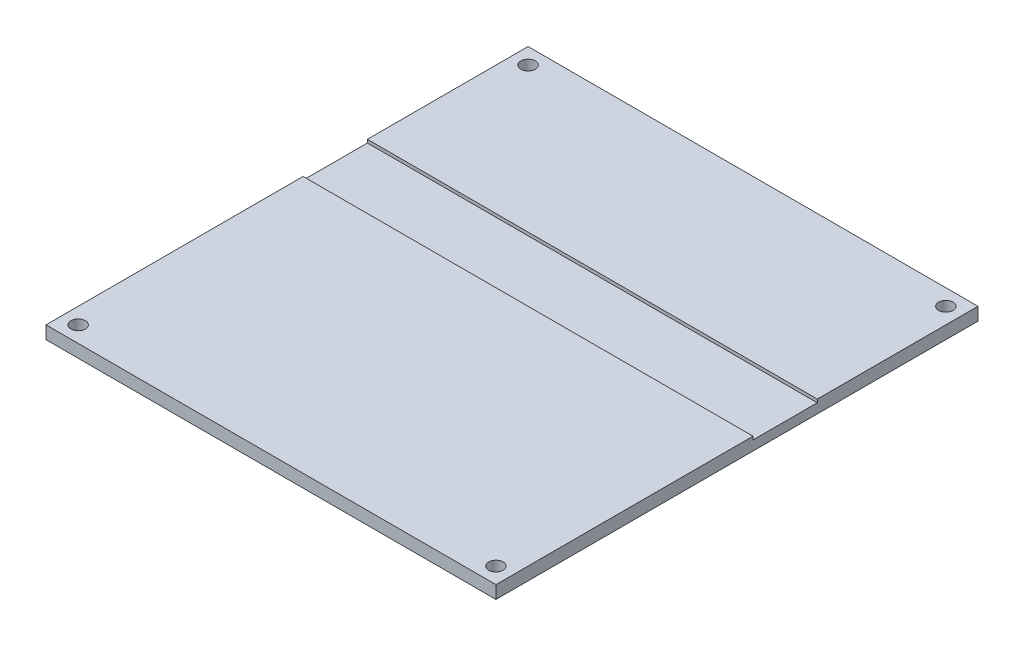
from build123d import *

# Parameters (mm, degrees)
SKETCH1_W                = 140
SKETCH1_H                = 150
BODY_DEPTH               = 4
MOUNTING_HOLES_OUTLINE_R = 2.25
MOUNTING_HOLES_DEPTH     = 4
SKETCH5_W                = 140
SKETCH5_H                = 20
CABLE_CANAL_DEPTH        = 1


# Read off the part's stored shape, not the designer's step: mounting_holes
with BuildPart() as part:
    # Sketch1 → body (new body)
    with BuildSketch(Plane(origin=(0, 0, 0), x_dir=(1, 0, 0), z_dir=(0, 1, 0))):
        Rectangle(SKETCH1_W, SKETCH1_H)
    extrude(amount=BODY_DEPTH)

    # mounting_holes outline → mounting_holes (cut)
    with BuildSketch(Plane(origin=(0, 0, 0), x_dir=(1, 0, 0), z_dir=(0, 1, 0))):
        with Locations((65, 70)):
            Circle(MOUNTING_HOLES_OUTLINE_R)
        with Locations((-65, -70)):
            Circle(MOUNTING_HOLES_OUTLINE_R)
        with Locations((65, -70)):
            Circle(MOUNTING_HOLES_OUTLINE_R)
        with Locations((-65, 70)):
            Circle(MOUNTING_HOLES_OUTLINE_R)
    extrude(amount=MOUNTING_HOLES_DEPTH, mode=Mode.SUBTRACT)

    # Sketch5 → cable_canal (cut)
    with BuildSketch(Plane(origin=(0, 4, 0), x_dir=(1, 0, 0), z_dir=(0, 1, 0))):
        with Locations((0, 15)):
            Rectangle(SKETCH5_W, SKETCH5_H)
    extrude(amount=-CABLE_CANAL_DEPTH, mode=Mode.SUBTRACT)


solid = part.part
